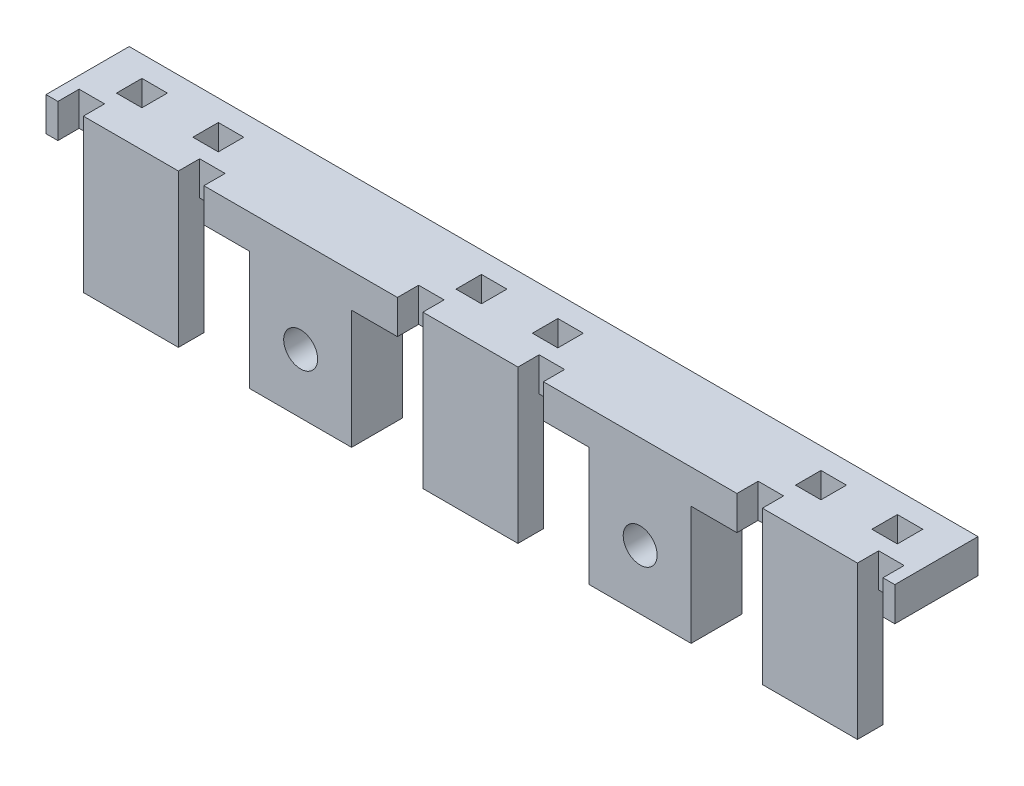
from build123d import *

# Parameters (mm, degrees)
SKETCH_1_W             = 117.567875581
SKETCH_1_H             = 35.211732604
EXTRUDE_1_DEPTH        = 2
SKETCH_3_W             = 1.5
SKETCH_3_H             = 1.5
CUT_EXTRUDE_1_DEPTH    = 123.743926455
PATTERN_LINEAR_1_COUNT = 3
PATTERN_LINEAR_1_PITCH = 20
SKETCH_4_OUTSIDE_W     = 144.116
SKETCH_4_OUTSIDE_H     = 61.76
SKETCH_4_OUTSIDE_W_2   = 50
SKETCH_4_OUTSIDE_H_2   = 4.9
CUT_EXTRUDE_2_DEPTH    = 123.743926455
SKETCH_5_W             = 5.6
SKETCH_5_H             = 1.5
SKETCH_5_W_2           = 6
EXTRUDE_2_DEPTH        = 7
SKETCH_6_R             = 1
CUT_EXTRUDE_4_DEPTH    = 51.601976246
EXTRUDE_START          = 1.5
SKETCH_7_W             = 6
SKETCH_7_H             = 7
SKETCH_7_R             = 1
EXTRUDE_3_DEPTH        = 1.5


with BuildPart() as part:
    # 草图1 → 凸台-拉伸1 (new body)
    with BuildSketch(Plane(origin=(0, 0, 0), x_dir=(1, 0, 0), z_dir=(0, 1, 0))):
        with Locations((58.783937791, -17.605866302)):
            Rectangle(SKETCH_1_W, SKETCH_1_H)
    extrude(amount=EXTRUDE_1_DEPTH)

    # 草图3 → 切除-拉伸1 (cut, through all)
    with BuildSketch(Plane(origin=(0, 2, 0), x_dir=(1, 0, 0), z_dir=(0, 1, 0))):
        with Locations((1.45, -4.4)):
            Rectangle(SKETCH_3_W, SKETCH_3_H)
        with Locations((8.55, -4.4)):
            Rectangle(SKETCH_3_W, SKETCH_3_H)
        with Locations((2.75, -2)):
            Rectangle(SKETCH_3_W, SKETCH_3_H)
        with Locations((7.25, -2)):
            Rectangle(SKETCH_3_W, SKETCH_3_H)
    cut_extrude_1 = extrude(amount=-CUT_EXTRUDE_1_DEPTH, mode=Mode.SUBTRACT)

    # 阵列(线性)1: 切除-拉伸1 ×3
    with Locations(*[(i * PATTERN_LINEAR_1_PITCH, 0, 0) for i in range(1, PATTERN_LINEAR_1_COUNT)]):
        add(cut_extrude_1, mode=Mode.SUBTRACT)

    # 草图4 outside → 切除-拉伸2 (cut, through all)
    with BuildSketch(Plane.XZ):
        with Locations((58.784, 17.606)):
            Rectangle(SKETCH_4_OUTSIDE_W, SKETCH_4_OUTSIDE_H)
        with Locations((25, 2.45)):
            Rectangle(SKETCH_4_OUTSIDE_W_2, SKETCH_4_OUTSIDE_H_2, mode=Mode.SUBTRACT)
    extrude(amount=-CUT_EXTRUDE_2_DEPTH, mode=Mode.SUBTRACT)

    # 草图5 → 凸台-拉伸2 (add)
    with BuildSketch(Plane.XZ):
        with Locations((45, 4.15)):
            Rectangle(SKETCH_5_W, SKETCH_5_H)
        with Locations((25, 4.15)):
            Rectangle(SKETCH_5_W, SKETCH_5_H)
        with Locations((5, 4.15)):
            Rectangle(SKETCH_5_W, SKETCH_5_H)
        with Locations((15, 4.15)):
            Rectangle(SKETCH_5_W_2, SKETCH_5_H)
        with Locations((35, 4.15)):
            Rectangle(SKETCH_5_W_2, SKETCH_5_H)
    extrude(amount=EXTRUDE_2_DEPTH)

    # 草图6 → 切除-拉伸4 (cut, through all)
    with BuildSketch(Plane(origin=(0, 0, 3.4), x_dir=(-1, 0, 0), z_dir=(0, 0, -1))):
        with Locations((-35, -3.5)):
            Circle(SKETCH_6_R)
        with Locations((-15, -3.5)):
            Circle(SKETCH_6_R)
    extrude(amount=-CUT_EXTRUDE_4_DEPTH, mode=Mode.SUBTRACT)

    # 草图7 → 凸台-拉伸3 (add)
    # profile 1 of 2: a face of its own
    with BuildSketch(Plane(origin=(0, 0, 3.4), x_dir=(-1, 0, 0), z_dir=(0, 0, -1)).offset(EXTRUDE_START)):
        with Locations((-35, -3.5)):
            Rectangle(SKETCH_7_W, SKETCH_7_H)
        with Locations((-35, -3.5)):
            Circle(SKETCH_7_R, mode=Mode.SUBTRACT)
    # profile 2 of 2: a face of its own
    with BuildSketch(Plane(origin=(0, 0, 3.4), x_dir=(-1, 0, 0), z_dir=(0, 0, -1)).offset(EXTRUDE_START)):
        with Locations((-15, -3.5)):
            Rectangle(SKETCH_7_W, SKETCH_7_H)
        with Locations((-15, -3.5)):
            Circle(SKETCH_7_R, mode=Mode.SUBTRACT)
    extrude(amount=-EXTRUDE_3_DEPTH)


solid = part.part
